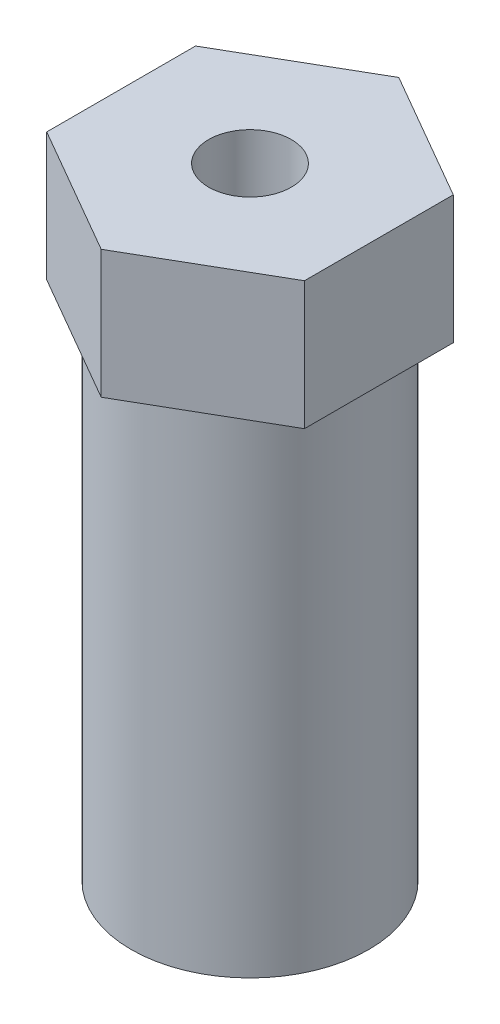
from build123d import *

# Parameters (mm, degrees)
SKETCH1_R           = 5.75
CYLINDERBASE_DEPTH  = 30.07
SKETCH2_R           = 3.34
THROUGHHOLE_DEPTH   = 32.15011878
BOSS_EXTRUDE2_DEPTH = 6.2
SKETCH4_R           = 2
CUT_EXTRUDE2_DEPTH  = 32.542430154


with BuildPart() as part:
    # Sketch1 → cylinderBase (new body)
    with BuildSketch(Plane(origin=(0, 0, 0), x_dir=(1, 0, 0), z_dir=(0, 1, 0))):
        Circle(SKETCH1_R)
    extrude(amount=CYLINDERBASE_DEPTH)

    # Sketch2 → throughHole (cut, through all)
    with BuildSketch(Plane(origin=(0, 30.07, 0), x_dir=(1, 0, 0), z_dir=(0, 1, 0))):
        Circle(SKETCH2_R)
    extrude(amount=-THROUGHHOLE_DEPTH, mode=Mode.SUBTRACT)

    # Sketch3 → Boss-Extrude2 (add)
    with BuildSketch(Plane(origin=(0, 30.07, 0), x_dir=(1, 0, 0), z_dir=(0, 1, 0))):
        Polygon((0, -7.2), (6.235382907, -3.6), (6.235382907, 3.6), (0, 7.2), (-6.235382907, 3.6), (-6.235382907, -3.6), align=None)
    extrude(amount=-BOSS_EXTRUDE2_DEPTH)

    # Sketch4 → Cut-Extrude2 (cut, through all)
    with BuildSketch(Plane(origin=(0, 30.07, 0), x_dir=(1, 0, 0), z_dir=(0, 1, 0))):
        Circle(SKETCH4_R)
    extrude(amount=-CUT_EXTRUDE2_DEPTH, mode=Mode.SUBTRACT)


solid = part.part
